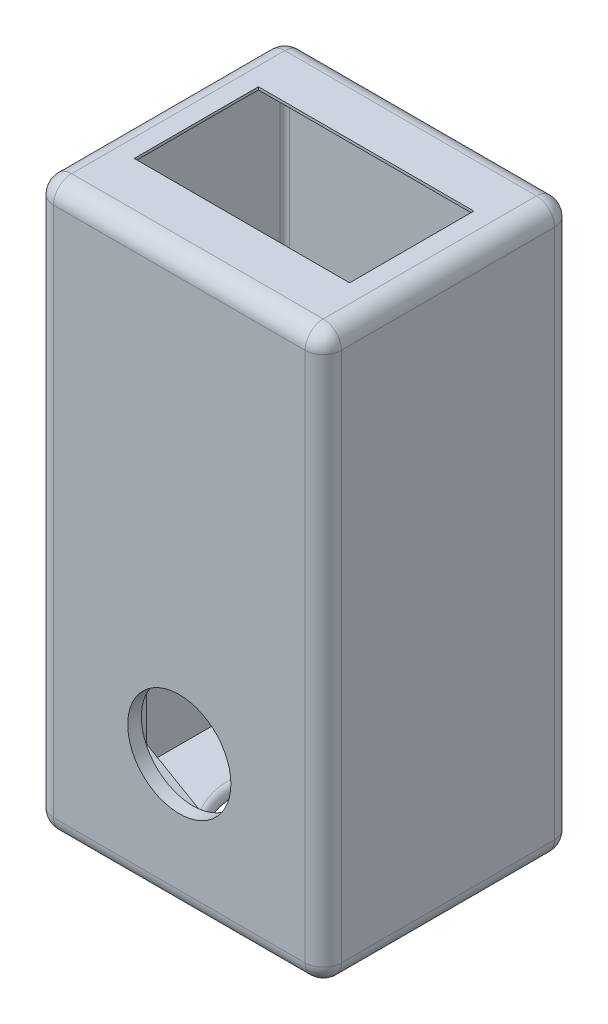
from build123d import *

# Parameters (mm, degrees)
PROFILE_SKETCH_W                         = 55
PROFILE_SKETCH_H                         = 125
PROFILE_EXTRUDE_DEPTH                    = 31.75
INTERIOR_START                           = -3
INTERIOR_SKETCH_W                        = 57.5
INTERIOR_SKETCH_H                        = 49
INTERIOR_CUT_DEPTH                       = 121.4
POWER_SWITCH_OPENING_CUT_REACH           = 142.207
OPENING_SKETCH_W                         = 47.5
OPENING_SKETCH_H                         = 27.4
INSIDE_TOP_CHAMFER_1_SIZE                = 5
INSIDE_TOP_CHAMFER_2_SIZE                = 10.8
STOP_BUTTON_HOLE_CUT_REACH               = 142.207
STOP_BUTTON_HOLE_SKETCH_R                = 11.375
NUT_START                                = -3
NUT_RECESS_EXTRUDE_DEPTH                 = 3
INSIDE_FILLETS_R                         = 1
WIRE_OUTLET_CUT_REACH                    = 142.207
WIRE_OUTLET_CUT_SKETCH_R                 = 15
NUT_RECESS_CHAMFER_FOR_PRINTABILITY_SIZE = 3
WIRE_OUTLET_FILLET_R                     = 1.5
TOP_FILLETS_R                            = 4


# Some blends are built 0.0001 mm under size
with BuildPart() as part:
    # Profile Sketch → Profile Extrude (new, symmetric)
    with BuildSketch(Plane(origin=(0, 0, 0), x_dir=(0, 0, -1), z_dir=(1, 0, 0))):
        with Locations((27.5, 62.5)):
            Rectangle(PROFILE_SKETCH_W, PROFILE_SKETCH_H)
    extrude(amount=PROFILE_EXTRUDE_DEPTH, both=True)

    # Interior Sketch → Interior Cut (cut)
    with BuildSketch(Plane.XZ.offset(INTERIOR_START)):
        with Locations((0, -27.5)):
            Rectangle(INTERIOR_SKETCH_W, INTERIOR_SKETCH_H)
    extrude(amount=-INTERIOR_CUT_DEPTH, mode=Mode.SUBTRACT)

    # Opening Sketch → Power Switch Opening Cut (cut, up to next)
    with BuildSketch(Plane(origin=(0, 125, 0), x_dir=(1, 0, 0), z_dir=(0, 1, 0)), mode=Mode.PRIVATE) as power_switch_opening_cut_sk1:
        with Locations((0, 27.5)):
            Rectangle(OPENING_SKETCH_W, OPENING_SKETCH_H)
    power_switch_opening_cut_tool1 = extrude(power_switch_opening_cut_sk1.sketch, amount=-POWER_SWITCH_OPENING_CUT_REACH, mode=Mode.PRIVATE) & part.part
    add(power_switch_opening_cut_tool1.solids().sort_by_distance((0, 125, -27.5))[0], mode=Mode.SUBTRACT)

    # Inside Top Chamfer 1
    # the kernel refuses this chamfer: 5 mm, written as the material it adds along each edge
    with BuildSketch(Plane(origin=(28.75, 124.4, -52), x_dir=(-0.9996219169112968, 0.0274958766105877, 0), z_dir=(0, 0, 1)), Plane(origin=(-28.75, 124.4, -3), x_dir=(0.9996219169112968, 0.0274958766105877, 0), z_dir=(0, 0, -1))) as inside_top_chamfer_1_piece_1:
        Polygon((INSIDE_TOP_CHAMFER_1_SIZE * 0.999621916911, INSIDE_TOP_CHAMFER_1_SIZE * 0.0274958766106), (-INSIDE_TOP_CHAMFER_1_SIZE * 0.0274958766106, INSIDE_TOP_CHAMFER_1_SIZE * 0.999621916911), (0, 0), align=None)
    extrude(amount=49)

    # Inside Top Chamfer 2
    inside_top_chamfer_2_edges = [part.edges().sort_by_distance(p)[0] for p in [
        (0, 124.4, -52),
        (0, 124.4, -3),
    ]]
    chamfer(inside_top_chamfer_2_edges, length=INSIDE_TOP_CHAMFER_2_SIZE - 0.0001)  # a hair under: the kernel refuses the full size

    # Stop Button Hole Sketch → Stop Button Hole Cut (cut, up to next)
    with BuildSketch(Plane.XY, mode=Mode.PRIVATE) as stop_button_hole_cut_sk1:
        with Locations((0, 30)):
            Circle(STOP_BUTTON_HOLE_SKETCH_R)
    stop_button_hole_cut_tool1 = extrude(stop_button_hole_cut_sk1.sketch, amount=-STOP_BUTTON_HOLE_CUT_REACH, mode=Mode.PRIVATE) & part.part
    add(stop_button_hole_cut_tool1.solids().sort_by_distance((0, 30, 0))[0], mode=Mode.SUBTRACT)

    # Stop Button Nut Sketch → Nut Recess Extrude (add)
    with BuildSketch(Plane.XY.offset(NUT_START)):
        Polygon((0, 8.926715175), (18.25, 19.463357587), (18.25, 40.536642413), (0, 51.073284825), (-18.25, 40.536642413), (-18.25, 19.463357587), align=None)
        Polygon((-13.25, 22.350108933), (0, 14.700217866), (13.25, 22.350108933), (13.25, 37.649891067), (0, 45.299782134), (-13.25, 37.649891067), align=None, mode=Mode.SUBTRACT)
    extrude(amount=-NUT_RECESS_EXTRUDE_DEPTH)

    # Inside Fillets
    inside_fillets_edges = [part.edges().sort_by_distance(p)[0] for p in [
        (28.75, 58.30005, -52),
        (-28.75, 58.30005, -52),
        (-28.75, 58.30005, -3),
        (28.75, 58.30005, -3),
    ]]
    fillet(inside_fillets_edges, radius=INSIDE_FILLETS_R)

    # Wire Outlet Cut Sketch → Wire Outlet Cut (cut, up to next)
    with BuildSketch(Plane.XZ, mode=Mode.PRIVATE) as wire_outlet_cut_sk1:
        with Locations(Location((0, -27.5, 0), (0, 0, 270))):
            Circle(WIRE_OUTLET_CUT_SKETCH_R)
    wire_outlet_cut_tool1 = extrude(wire_outlet_cut_sk1.sketch, amount=-WIRE_OUTLET_CUT_REACH, mode=Mode.PRIVATE) & part.part
    add(wire_outlet_cut_tool1.solids().sort_by_distance((0, 0, -27.5))[0], mode=Mode.SUBTRACT)

    # Nut Recess Chamfer for Printability
    nut_recess_chamfer_for_printability_edges = [part.edges().sort_by_distance(p)[0] for p in [
        (9.125, 14.195036381, -3),
        (-9.125, 14.195036381, -3),
    ]]
    chamfer(nut_recess_chamfer_for_printability_edges, length=NUT_RECESS_CHAMFER_FOR_PRINTABILITY_SIZE - 0.0001)  # a hair under: the kernel refuses the full size

    # Wire Outlet Fillet
    wire_outlet_fillet_edges = [part.edges().sort_by_distance(p)[0] for p in [
        (0, 0, -12.5),
        (0, 3, -12.5),
    ]]
    fillet(wire_outlet_fillet_edges, radius=WIRE_OUTLET_FILLET_R - 0.0001)  # a hair under: the kernel refuses the full size

    # Top Fillets
    top_fillets_edges = [part.edges().sort_by_distance(p)[0] for p in [
        (31.75, 125, -27.5),
        (31.75, 62.5, 0),
        (31.75, 0, -27.5),
        (-31.75, 62.5, 0),
        (-31.75, 125, -27.5),
        (-31.75, 62.5, -55),
        (-31.75, 0, -27.5),
        (0, 0, 0),
        (0, 125, 0),
        (0, 125, -55),
        (0, 0, -55),
        (31.75, 62.5, -55),
    ]]
    fillet(top_fillets_edges, radius=TOP_FILLETS_R)


solid = part.part
